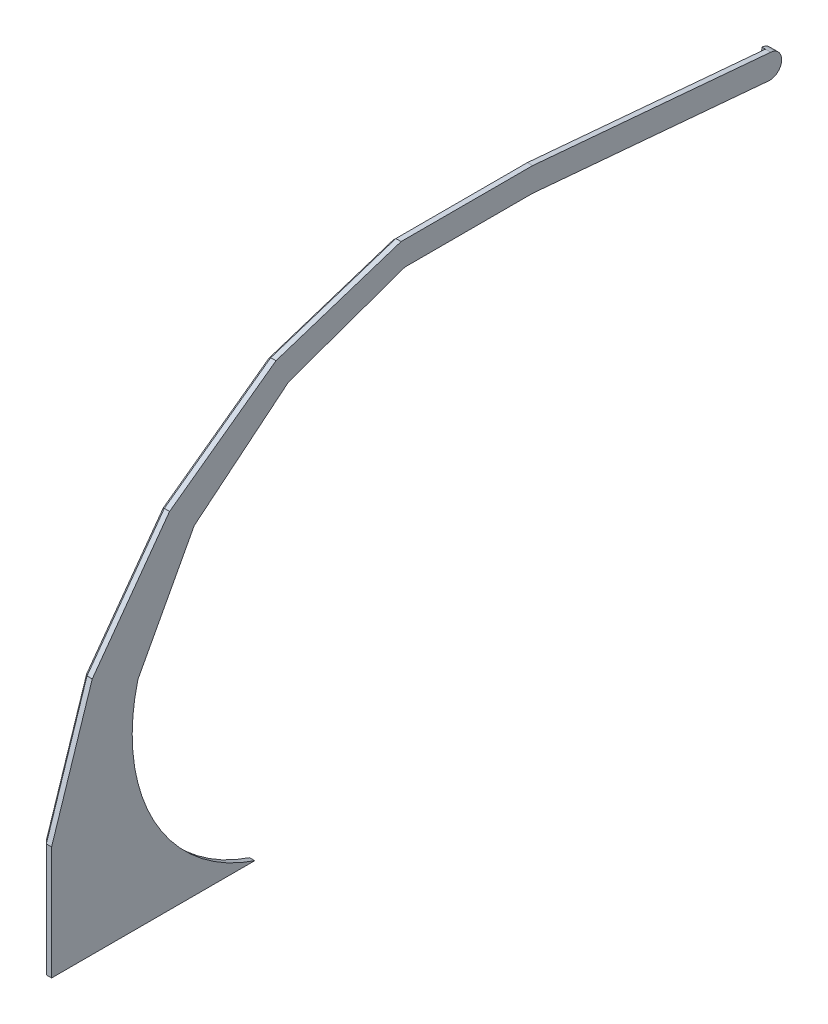
from build123d import *

# Parameters (mm, degrees)
BOSS_EXTRUDE1_DEPTH = 4.4
BOSS_EXTRUDE2_DEPTH = 3


with BuildPart() as part:
    # Sketch1 → Boss-Extrude1 (new body)
    with BuildSketch(Plane(origin=(0, 0, 0), x_dir=(0, 0, -1), z_dir=(1, 0, 0))):
        with BuildLine():
            Line((12.615293263, -92.633282396), (182.615293263, -92.633282396))
            ThreePointArc((182.615293263, -92.633282396), (98.271459614, -21.762843967), (84.825943994, 87.579368501))
            Line((84.825943994, 87.579368501), (131.929787104, 175.483372313))
            Line((131.929787104, 175.483372313), (210.884858569, 240.150484061))
            Line((210.884858569, 240.150484061), (308.236471933, 274.689971372))
            Line((308.236471933, 274.689971372), (415.1194685, 274.721469403))
            Line((415.1194685, 274.721469403), (612.615293263, 257.442823643))
            ThreePointArc((612.615293263, 257.442823643), (623.448797672, 266.533213196), (614.358408118, 277.366717604))
            Line((614.358408118, 277.366717604), (415.1194685, 294.797866154))
            Line((415.1194685, 294.797866154), (305.051694272, 294.797866154))
            Line((305.051694272, 294.797866154), (200.371020359, 260.785053385))
            Line((200.371020359, 260.785053385), (111.324320476, 196.088838941))
            Line((111.324320476, 196.088838941), (46.628106033, 107.042139058))
            Line((46.628106033, 107.042139058), (12.615293263, 2.361465145))
            Line((12.615293263, 2.361465145), (12.615293263, -92.633282396))
        make_face()
    extrude(amount=-BOSS_EXTRUDE1_DEPTH)

    # Sketch2 → Boss-Extrude2 (add)
    with BuildSketch(Plane.ZY.offset(4.4)):
        with BuildLine():
            Line((-614.358408118, 277.366717604), (-614.09694089, 274.37813351))
            Line((-614.09694089, 274.37813351), (-415.1194685, 291.786406641))
            Line((-415.1194685, 291.786406641), (-305.528662602, 291.786406641))
            Line((-305.528662602, 291.786406641), (-201.755236364, 258.068376511))
            Line((-201.755236364, 258.068376511), (-113.48028745, 193.932871967))
            Line((-113.48028745, 193.932871967), (-49.344782906, 105.657923053))
            Line((-49.344782906, 105.657923053), (-15.811778295, 2.453946809))
            Line((-15.811778295, 2.453946809), (-15.811778295, -92.633282396))
            Line((-15.811778295, -92.633282396), (-101.905821199, -92.633282396))
            Line((-101.905821199, -92.633282396), (-66.148126422, 3.910293146))
            Line((-66.148126422, 3.910293146), (-82.152924422, 88.94134))
            Line((-82.152924422, 88.94134), (-129.839029338, 177.574130079))
            Line((-129.839029338, 177.574130079), (-209.517623645, 242.833833686))
            Line((-209.517623645, 242.833833686), (-307.761340769, 277.689831483))
            Line((-307.761340769, 277.689831483), (-415.250010124, 277.721508004))
            Line((-415.250010124, 277.721508004), (-612.876760491, 260.431407737))
            Line((-612.876760491, 260.431407737), (-612.615293263, 257.442823643))
            ThreePointArc((-612.615293263, 257.442823643), (-623.448797672, 266.533213196), (-614.358408118, 277.366717604))
        make_face()
        Polygon((-563.8078494, 273.256849808), (-553.2481856, 274.180700681), (-552.934424927, 270.594399768), (-563.494088726, 269.670548895), align=None, mode=Mode.SUBTRACT)
        Polygon((-473.552609753, 281.153160101), (-462.992945953, 282.077010974), (-462.679185279, 278.490710061), (-473.238849079, 277.566859188), align=None, mode=Mode.SUBTRACT)
        Polygon((-618.923562928, 268.735995644), (-608.363899128, 269.659846517), (-608.050138454, 266.073545604), (-618.609802254, 265.14969473), align=None, mode=Mode.SUBTRACT)
    extrude(amount=BOSS_EXTRUDE2_DEPTH)


solid = part.part
